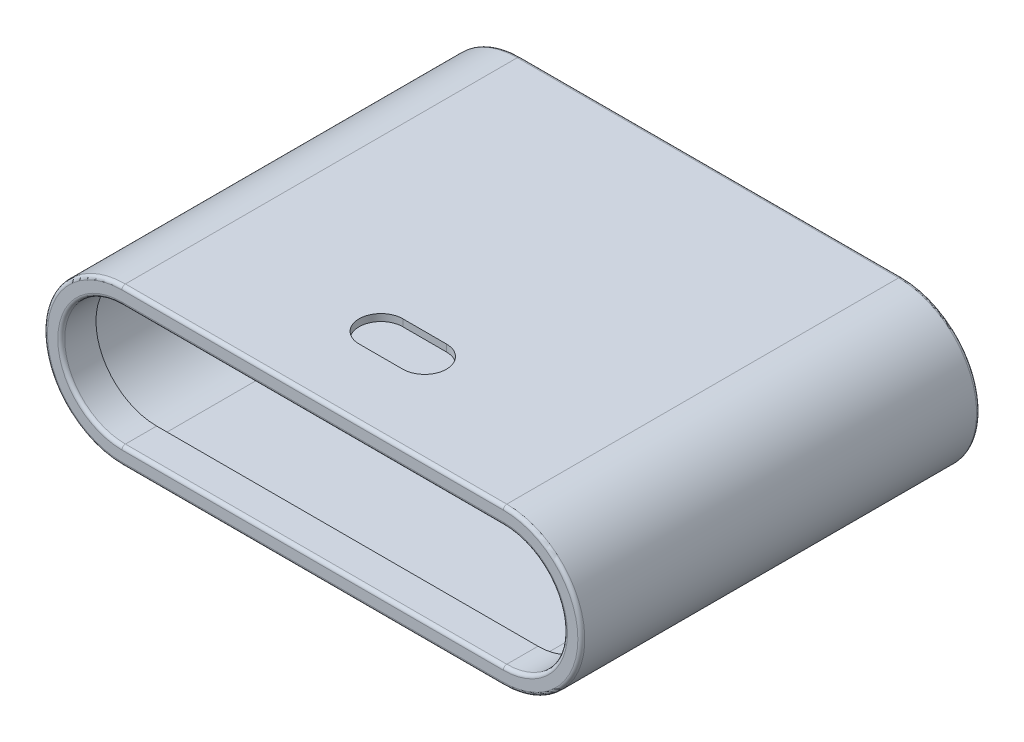
from build123d import *

# Parameters (mm, degrees)
BOSS_EXTRU_1_DEPTH      = 115
ENL_V_MAT_EXTRU_1_DEPTH = 10
ENL_V_MAT_EXTRU_2_DEPTH = 105
ESQUISSE4_R             = 2
BOSS_EXTRU_2_DEPTH      = 5
CHANFREIN1_SIZE         = 7.5
ENL_V_MAT_EXTRU_3_REACH = 147.795
CONG_1_R                = 1


with BuildPart() as part:
    # Esquisse1 → Boss.-Extru.1 (new body)
    with BuildSketch(Plane.XY):
        with BuildLine():
            Line((-55, 22.5), (55, 22.5))
            ThreePointArc((55, 22.5), (77.5, 0), (55, -22.5))
            Line((55, -22.5), (-55, -22.5))
            ThreePointArc((-55, -22.5), (-77.5, 0), (-55, 22.5))
        make_face()
    extrude(amount=BOSS_EXTRU_1_DEPTH)

    # Esquisse2 → Enlèv. mat.-Extru.1 (cut)
    with BuildSketch(Plane.XY.offset(115)):
        with BuildLine():
            Line((-55, -17.5), (55, -17.5))
            ThreePointArc((55, -17.5), (72.5, 0), (55, 17.5))
            Line((55, 17.5), (-55, 17.5))
            ThreePointArc((-55, 17.5), (-72.5, 0), (-55, -17.5))
        make_face()
    extrude(amount=-ENL_V_MAT_EXTRU_1_DEPTH, mode=Mode.SUBTRACT)

    # Esquisse3 → Enlèv. mat.-Extru.2 (cut)
    with BuildSketch(Plane(origin=(0, 0, 0), x_dir=(-1, 0, 0), z_dir=(0, 0, -1))):
        with BuildLine():
            Line((55, 20.5), (-55, 20.5))
            ThreePointArc((-55, 20.5), (-75.5, 0), (-55, -20.5))
            Line((-55, -20.5), (55, -20.5))
            ThreePointArc((55, -20.5), (75.5, 0), (55, 20.5))
        make_face()
    extrude(amount=-ENL_V_MAT_EXTRU_2_DEPTH, mode=Mode.SUBTRACT)

    # Esquisse4 → Boss.-Extru.2 (add)
    with BuildSketch(Plane(origin=(0, 0, 5), x_dir=(-1, 0, 0), z_dir=(0, 0, -1))):
        with BuildLine():
            ThreePointArc((-74.12804878, 7.373448979), (-68, 0), (-74.12804878, -7.373448979))
            ThreePointArc((-74.12804878, -7.373448979), (-75.5, 0), (-74.12804878, 7.373448979))
        make_face()
        with Locations((-71.5, 0)):
            Circle(ESQUISSE4_R, mode=Mode.SUBTRACT)
    boss_extru_2 = extrude(amount=-BOSS_EXTRU_2_DEPTH)

    # Symétrie1: Boss.-Extru.2 across plane
    add(boss_extru_2.mirror(Plane(origin=(0, 0, 0), x_dir=(0, 0, 1), z_dir=(1, 0, 0))))

    # Chanfrein1
    # the kernel refuses this chamfer: 7.5 mm, written as the material it adds along each edge
    with BuildSketch(Plane(origin=(55, 0, 10), x_dir=(0.25894364440862044, -0.9658924313920169, 0), z_dir=(-0.9658924313920169, -0.25894364440862044, 0))) as chanfrein1_piece_1_section:
        Polygon((20.5, CHANFREIN1_SIZE), (20.5 - CHANFREIN1_SIZE, 0), (20.5, 0), align=None)
    chanfrein1_piece_1 = revolve(axis=Axis((55, 0, 10), (0, 0, 1)), revolution_arc=149.985218041, mode=Mode.PRIVATE)
    chanfrein1_piece_1 = chanfrein1_piece_1 & Plane(origin=(75.5, 0, 16.376958041), x_dir=(-0.1829268292682967, 0.9831265305818206, 0), z_dir=(0, 0, -1)) * Cylinder(7.5, 83, mode=Mode.PRIVATE)
    chanfrein1_piece_1 = chanfrein1_piece_1 - Plane(origin=(71.5, 0, 16.376958041), x_dir=(-1, 0, 0), z_dir=(0, 0, -1)) * Cylinder(2, 83, mode=Mode.PRIVATE)
    add(chanfrein1_piece_1)
    with BuildSketch(Plane(origin=(-55, 0, 10), x_dir=(-0.2589436444086207, -0.9658924313920167, 0), z_dir=(0.9658924313920167, -0.2589436444086207, 0))) as chanfrein1_piece_2_section:
        Polygon((20.5, -CHANFREIN1_SIZE), (20.5 - CHANFREIN1_SIZE, 0), (20.5, 0), align=None)
    chanfrein1_piece_2 = revolve(axis=Axis((-55, 0, 10), (0, 0, -1)), revolution_arc=149.985218041, mode=Mode.PRIVATE)
    chanfrein1_piece_2 = chanfrein1_piece_2 & Plane(origin=(-75.5, 0, 16.376958041), x_dir=(0.1829268292682967, 0.9831265305818206, 0), z_dir=(0, 0, -1)) * Cylinder(7.5, 83, mode=Mode.PRIVATE)
    chanfrein1_piece_2 = chanfrein1_piece_2 - Plane(origin=(-71.5, 0, 16.376958041), x_dir=(1, 0, 0), z_dir=(0, 0, -1)) * Cylinder(2, 83, mode=Mode.PRIVATE)
    add(chanfrein1_piece_2)

    # Esquisse5 → Enlèv. mat.-Extru.3 (cut, up to next)
    with BuildSketch(Plane(origin=(0, 22.5, 0), x_dir=(1, 0, 0), z_dir=(0, 1, 0)), mode=Mode.PRIVATE) as enl_v_mat_extru_3_sk1:
        with BuildLine():
            Line((-6.3, -82.7), (6.3, -82.7))
            ThreePointArc((6.3, -82.7), (12.6, -89), (6.3, -95.3))
            Line((6.3, -95.3), (-6.3, -95.3))
            ThreePointArc((-6.3, -95.3), (-12.6, -89), (-6.3, -82.7))
        make_face()
    enl_v_mat_extru_3_tool1 = extrude(enl_v_mat_extru_3_sk1.sketch, amount=-ENL_V_MAT_EXTRU_3_REACH, mode=Mode.PRIVATE) & part.part
    add(enl_v_mat_extru_3_tool1.solids().sort_by_distance((0, 22.5, 89))[0], mode=Mode.SUBTRACT)

    # Congé1
    cong_1_edges = [part.edges().sort_by_distance(p)[0] for p in [
        (77.5, 0, 115),
        (0, 22.5, 115),
        (-72.5, 0, 115),
        (0, -17.5, 115),
        (72.5, 0, 115),
        (0, 17.5, 115),
        (-77.5, 0, 115),
        (0, 22.5, 0),
        (77.5, 0, 0),
        (0, -22.5, 0),
        (-77.5, 0, 0),
        (0, -22.5, 115),
    ]]
    fillet(cong_1_edges, radius=CONG_1_R)


solid = part.part
